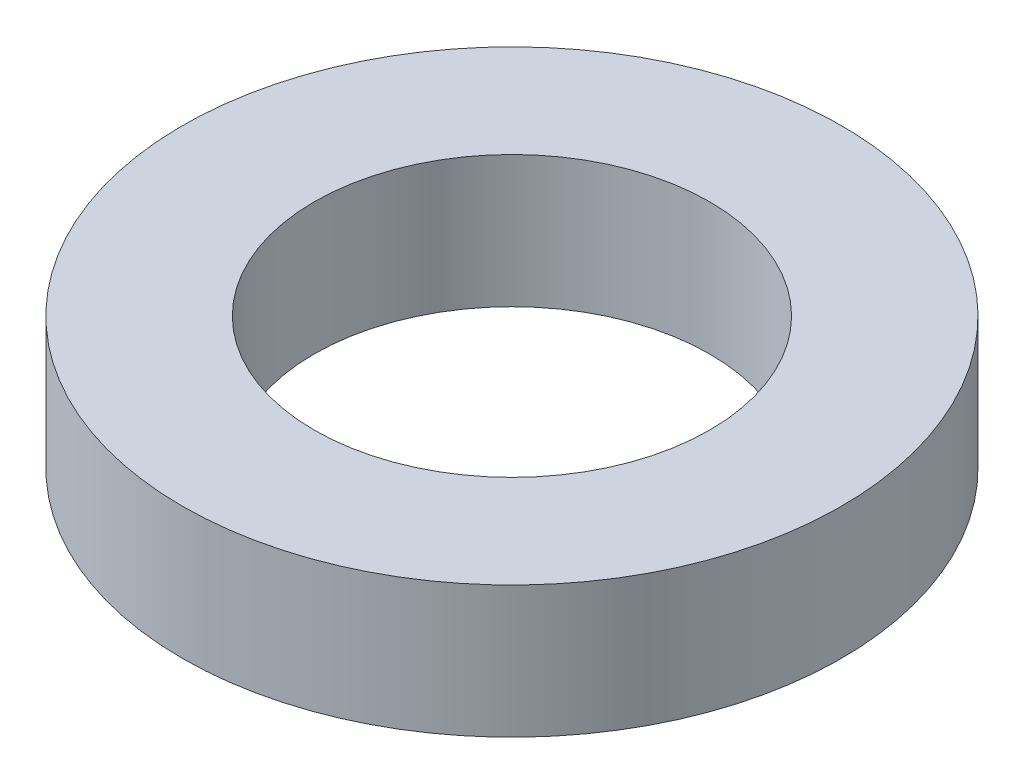
from build123d import *

# Parameters (mm, degrees)
SKETCH1_R           = 2.5
SKETCH1_R_2         = 1.5
BOSS_EXTRUDE1_DEPTH = 1


with BuildPart() as part:
    # Sketch1 → Boss-Extrude1 (new body)
    with BuildSketch(Plane(origin=(0, 0, 0), x_dir=(1, 0, 0), z_dir=(0, 1, 0))):
        Circle(SKETCH1_R)
        Circle(SKETCH1_R_2, mode=Mode.SUBTRACT)
    extrude(amount=BOSS_EXTRUDE1_DEPTH)


solid = part.part
